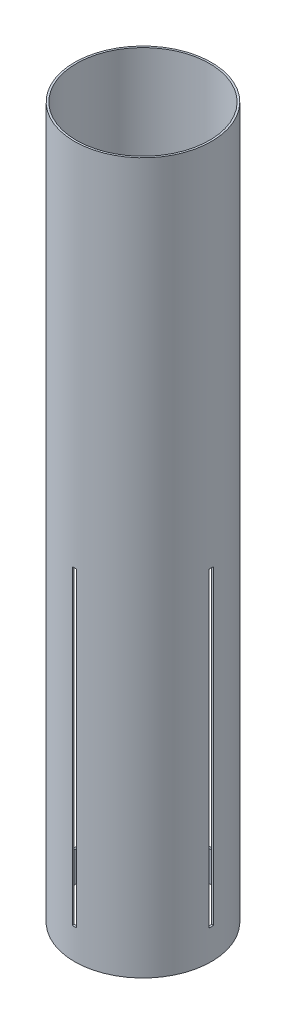
from build123d import *

# Parameters (mm, degrees)
SUSTAINER_TUBE_PROFILE_3_R   = 78.359
SUSTAINER_TUBE_PROFILE_3_R_2 = 76.2
BOSS_EXTRUDE2_DEPTH          = 812.8
CUT_EXTRUDE2_REACH           = 833.471
CUT_EXTRUDE2_END_RADIUS      = 76.2
SKETCH2_W                    = 5.08
SKETCH2_H                    = 355.6
CIRPATTERN2_COUNT            = 4


with BuildPart() as part:
    # Sustainer Tube Profile<3> → Boss-Extrude2 (new body)
    with BuildSketch(Plane(origin=(0, 0, 0), x_dir=(1, 0, 0), z_dir=(0, 1, 0))):
        Circle(SUSTAINER_TUBE_PROFILE_3_R)
        Circle(SUSTAINER_TUBE_PROFILE_3_R_2, mode=Mode.SUBTRACT)
    extrude(amount=BOSS_EXTRUDE2_DEPTH)

    # Cut-Extrude2: up to this cylinder (the profile starts outside it)
    cut_extrude2_end = Plane(origin=(0, 212.471, 0), z_dir=(0, -1, 0)) * Cylinder(CUT_EXTRUDE2_END_RADIUS, 1820.342, mode=Mode.PRIVATE)
    # Sketch2 → Cut-Extrude2 (cut, up to the surface)
    with BuildSketch(Plane.XY.offset(78.359), mode=Mode.PRIVATE) as cut_extrude2_sk1:
        with Locations((0, 212.471)):
            Rectangle(SKETCH2_W, SKETCH2_H)
    cut_extrude2_tool1 = extrude(cut_extrude2_sk1.sketch, amount=-CUT_EXTRUDE2_REACH, mode=Mode.PRIVATE) - cut_extrude2_end
    cut_extrude2 = cut_extrude2_tool1.solids().sort_by_distance((0, 212.471, 78.359))[0]
    add(cut_extrude2, mode=Mode.SUBTRACT)

    # CirPattern2: Cut-Extrude2 ×4 about axis
    cirpattern2_axis = Axis((0, 812.8, 0), (0, 1, 0))
    for i in range(1, CIRPATTERN2_COUNT):
        add(cut_extrude2.rotate(cirpattern2_axis, i * 360 / CIRPATTERN2_COUNT), mode=Mode.SUBTRACT)


solid = part.part
